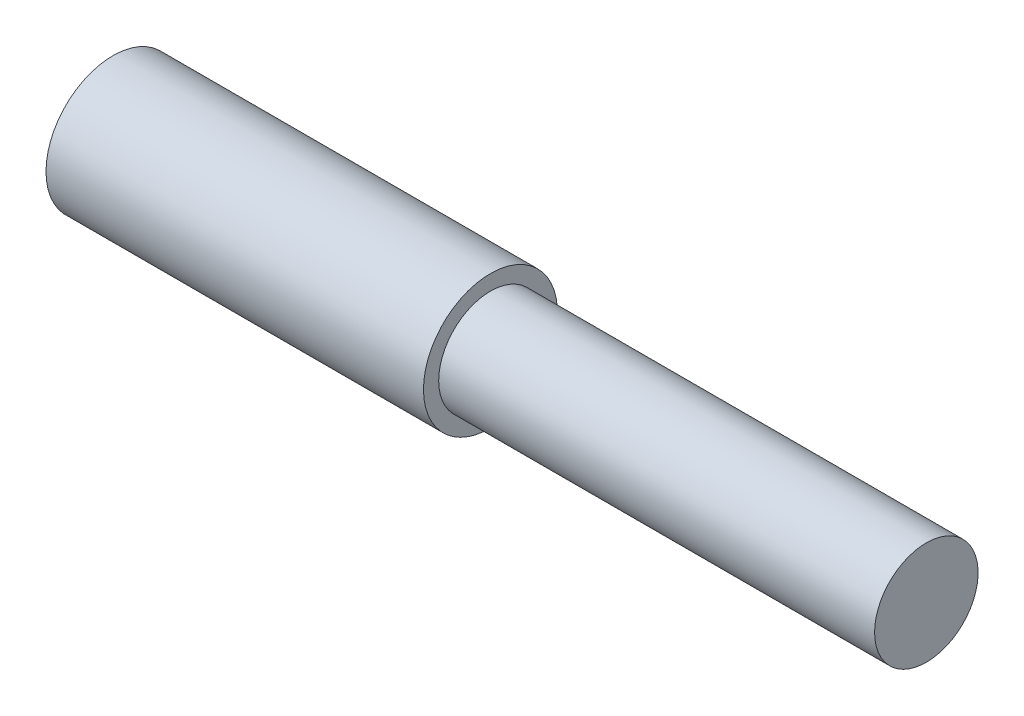
from build123d import *


with BuildPart() as part:
    # Sketch1 → Revolve1 (revolve)
    with BuildSketch(Plane.XY):
        Polygon((0, 2.75), (-15.5, 2.75), (-15.5, 0), (17.9, 0), (17.9, 2.125), (0, 2.125), align=None)
    revolve(axis=Axis((-9.458937198, 0, 0), (1, 0, 0)))


solid = part.part
